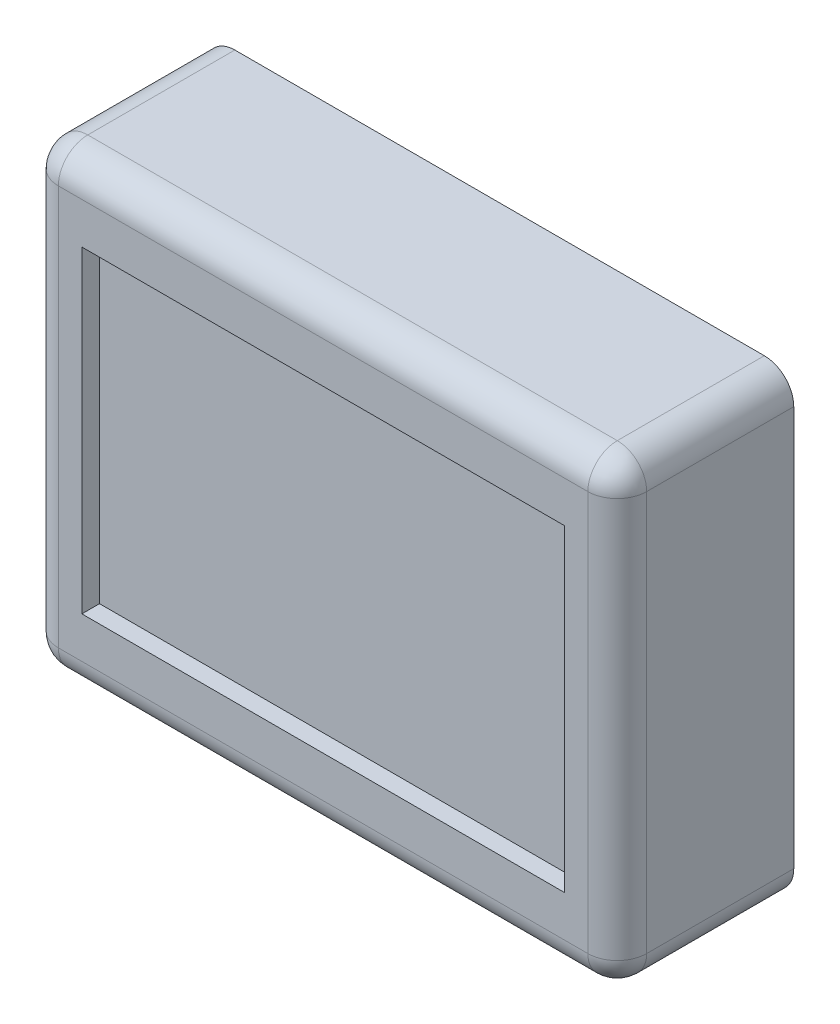
from build123d import *

# Parameters (mm, degrees)
SKETCH1_W           = 100
SKETCH1_H           = 78
BOSS_EXTRUDE1_DEPTH = 30
SKETCH3_W           = 82
SKETCH3_H           = 54
CUT_EXTRUDE1_DEPTH  = 3
SHELL1_T            = -3
FILLET1_R           = 5
FILLET2_R           = 5


with BuildPart() as part:
    # Sketch1 → Boss-Extrude1 (new body)
    with BuildSketch(Plane.XY):
        with Locations((8.119223597, 15.253918495)):
            Rectangle(SKETCH1_W, SKETCH1_H)
    extrude(amount=-BOSS_EXTRUDE1_DEPTH)

    # Sketch3 → Cut-Extrude1 (cut)
    with BuildSketch(Plane.XY):
        with Locations((8.119223597, 15.253918495)):
            Rectangle(SKETCH3_W, SKETCH3_H)
    extrude(amount=-CUT_EXTRUDE1_DEPTH, mode=Mode.SUBTRACT)

    # Shell1
    shell1_openings = [part.faces().sort_by_distance(p)[0] for p in [
        (8.119223597, 15.253918495, -30),
    ]]
    offset(amount=SHELL1_T, openings=shell1_openings, kind=Kind.INTERSECTION)

    # Fillet1
    fillet1_edges = [part.edges().sort_by_distance(p)[0] for p in [
        (8.119223597, -23.746081505, 0),
        (-41.880776403, 15.253918495, 0),
        (8.119223597, 54.253918495, 0),
        (58.119223597, 15.253918495, 0),
        (58.119223597, -23.746081505, -15),
        (-41.880776403, -23.746081505, -15),
        (-41.880776403, 54.253918495, -15),
        (58.119223597, 54.253918495, -15),
    ]]
    fillet(fillet1_edges, radius=FILLET1_R)

    # Fillet2
    # the kernel refuses this fillet: 5 mm, written as the material it adds along each edge
    with BuildSketch(Plane(origin=(55.119223597, -20.746081505, -3), x_dir=(0, 0, -1), z_dir=(0, 1, 0))) as fillet2_piece_1:
        with BuildLine():
            CenterArc((FILLET2_R, FILLET2_R), FILLET2_R, 180, 90)
            Line((0, FILLET2_R), (0, 0))
            Line((0, 0), (FILLET2_R, 0))
        make_face()
    extrude(amount=72)
    with BuildSketch(Plane(origin=(-38.880776403, 51.253918495, -3), x_dir=(0, 0, -1), z_dir=(1, 0, 0))) as fillet2_piece_2:
        with BuildLine():
            CenterArc((FILLET2_R, -FILLET2_R), FILLET2_R, 90, 90)
            Line((0, -FILLET2_R), (0, 0))
            Line((0, 0), (FILLET2_R, 0))
        make_face()
    extrude(amount=94)


solid = part.part
